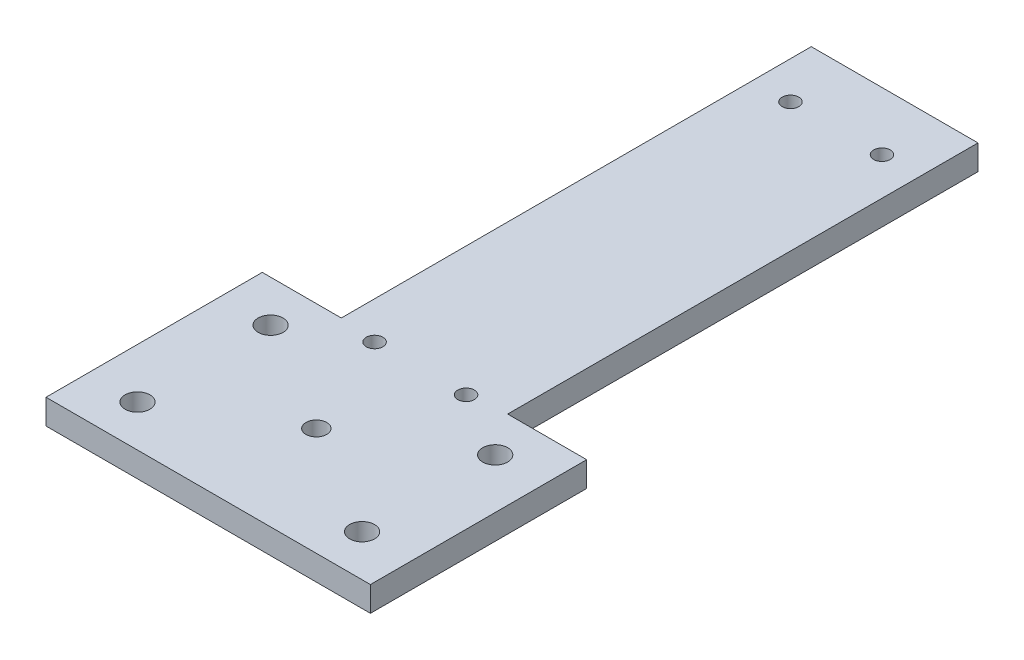
from build123d import *

# Parameters (mm, degrees)
SKETCH2_R           = 3
SKETCH2_R_2         = 2
SKETCH2_R_3         = 2.5
BOSS_EXTRUDE1_DEPTH = 6


with BuildPart() as part:
    # Sketch2 → Boss-Extrude1 (new body)
    with BuildSketch(Plane(origin=(0, 1180.436182905, 0), x_dir=(1, 0, 0), z_dir=(0, 1, 0))):
        Polygon((831.360427755, -1807.911067916), (791.275007126, -1807.911067916), (791.275007126, -1920.911067916), (772.275007126, -1920.911067916), (772.275007126, -1972.911067916), (850.275007126, -1972.911067916), (850.275007126, -1920.911035629), (831.275007126, -1920.911035629), align=None)
        with Locations((784.275007126, -1962.911067916)):
            Circle(SKETCH2_R, mode=Mode.SUBTRACT)
        with Locations((784.275007126, -1930.911067916)):
            Circle(SKETCH2_R, mode=Mode.SUBTRACT)
        with Locations((800.275007126, -1921.911067916)):
            Circle(SKETCH2_R_2, mode=Mode.SUBTRACT)
        with Locations((811.275007126, -1946.911067916)):
            Circle(SKETCH2_R_3, mode=Mode.SUBTRACT)
        with Locations((838.275007126, -1962.911067916)):
            Circle(SKETCH2_R, mode=Mode.SUBTRACT)
        with Locations((822.275007126, -1921.911067916)):
            Circle(SKETCH2_R_2, mode=Mode.SUBTRACT)
        with Locations((838.275007126, -1930.911067916)):
            Circle(SKETCH2_R, mode=Mode.SUBTRACT)
        with Locations((800.275007126, -1821.911067916)):
            Circle(SKETCH2_R_2, mode=Mode.SUBTRACT)
        with Locations((822.275007126, -1821.911067916)):
            Circle(SKETCH2_R_2, mode=Mode.SUBTRACT)
    extrude(amount=BOSS_EXTRUDE1_DEPTH)


solid = part.part
